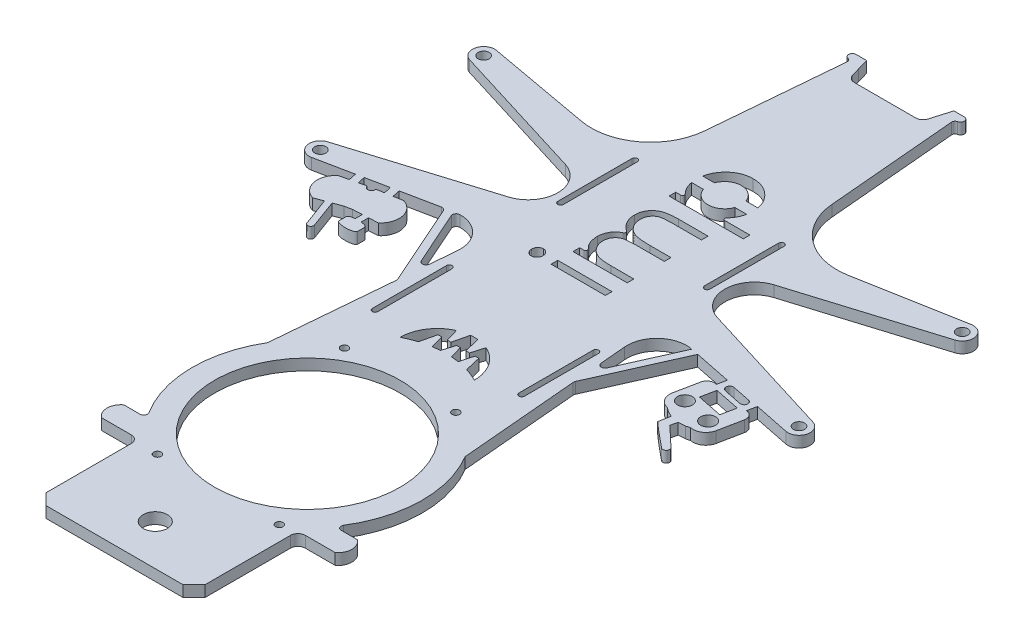
from build123d import *

# Parameters (mm, degrees)
SKETCH_1_R          = 1.5
SKETCH_1_R_2        = 25
SKETCH_1_R_3        = 1
SKETCH_1_R_4        = 2
EXTRUDE_1_DEPTH     = 3
CUT_EXTRUDE_1_DEPTH = 3
EXTRUDE_2_DEPTH     = 3
CUT_EXTRUDE_2_DEPTH = 3
SKETCH_6_R          = 3.25
EXTRUDE_3_DEPTH     = 3
EXTRUDE_4_DEPTH     = 3
SKETCH_8_W          = 14.615384615
SKETCH_8_H          = 1.794871795
CUT_EXTRUDE_3_DEPTH = 10
EXTRUDE_6_DEPTH     = 3
FILLET_2_R          = 2
FILLET_3_R          = 2
FILLET_4_R          = 1
FILLET_5_R          = 1
EXTRUDE_7_DEPTH     = 3
FILLET_6_R          = 1
FILLET_7_R          = 1
FILLET_11_R         = 1
FILLET_12_R         = 1
FILLET_13_R         = 1
FILLET_14_R         = 1
FILLET_22_R         = 0.5
FILLET_23_R         = 0.5
FILLET_24_R         = 0.5
FILLET_25_R         = 0.5
EXTRUDE_8_DEPTH     = 3


with BuildPart() as part:
    # 草图1 → 凸台-拉伸1 (new body)
    with BuildSketch(Plane(origin=(0, 0, 0), x_dir=(1, 0, 0), z_dir=(0, 1, 0))):
        with BuildLine():
            Line((-65.384333619, -19.133302588), (-28.141777015, -7.644526431))
            ThreePointArc((-28.141777015, -7.644526431), (-22.5, 0), (-28.141777015, 7.644526431))
            Line((-28.141777015, 7.644526431), (-65.384333619, 19.133302588))
            ThreePointArc((-65.384333619, 19.133302588), (-67.41435877, 22.711697239), (-63.963475544, 24.951633702))
            Line((-63.963475544, 24.951633702), (-35.956989403, 19.860837807))
            ThreePointArc((-35.956989403, 19.860837807), (-23.387681178, 22.884481961), (-17.156151846, 34.211351583))
            Line((-17.156151846, 34.211351583), (-14.077866308, 69.471713196))
            ThreePointArc((-14.077866308, 69.471713196), (-14.227947416, 70.111656421), (-14.777866308, 70.471713196))
            ThreePointArc((-14.777866308, 70.471713196), (-15.58285387, 71.562211952), (-14.577866308, 72.471713196))
            Line((-14.577866308, 72.471713196), (-11.764219385, 72.471713196))
            Line((-11.764219385, 72.471713196), (-10.884480237, 69.471713196))
            Line((-10.884480237, 69.471713196), (-10.181933712, 67.110709467))
            ThreePointArc((-10.181933712, 67.110709467), (-9.460655522, 66.077868179), (-8.265, 65.681117341))
            Line((-8.265, 65.681117341), (8.265, 65.681117341))
            ThreePointArc((8.265, 65.681117341), (9.462435388, 66.079197089), (10.183195998, 67.114968849))
            Line((10.183195998, 67.114968849), (10.878780421, 69.471713196))
            Line((10.878780421, 69.471713196), (11.764219385, 72.471713196))
            Line((11.764219385, 72.471713196), (14.577866308, 72.471713196))
            ThreePointArc((14.577866308, 72.471713196), (15.58285387, 71.562211952), (14.777866308, 70.471713196))
            ThreePointArc((14.777866308, 70.471713196), (14.227947416, 70.111656421), (14.077866308, 69.471713196))
            Line((14.077866308, 69.471713196), (17.156151846, 34.211351583))
            ThreePointArc((17.156151846, 34.211351583), (23.387681178, 22.884481961), (35.956989403, 19.860837807))
            Line((35.956989403, 19.860837807), (63.963475544, 24.951633702))
            ThreePointArc((63.963475544, 24.951633702), (67.41435877, 22.711697239), (65.384333619, 19.133302588))
            Line((65.384333619, 19.133302588), (28.141777015, 7.644526431))
            ThreePointArc((28.141777015, 7.644526431), (22.5, 0), (28.141777015, -7.644526431))
            Line((28.141777015, -7.644526431), (65.384333619, -19.133302588))
            ThreePointArc((65.384333619, -19.133302588), (67.406788203, -22.742012359), (63.902111383, -24.939817886))
            Line((63.902111383, -24.939817886), (56.552566669, -23.445096344))
            Line((56.552566669, -23.445096344), (54.298706289, -22.986715071))
            Line((54.298706289, -22.986715071), (53.800465775, -25.436563309))
            Line((53.800465775, -25.436563309), (54.094447564, -25.496352171))
            ThreePointArc((54.094447564, -25.496352171), (55.363545991, -26.352234716), (55.655733743, -27.854823172))
            Line((55.655733743, -27.854823172), (54.360308407, -34.224428592))
            ThreePointArc((54.360308407, -34.224428592), (52.862513952, -36.44535084), (50.232984154, -36.956679406))
            Line((50.232984154, -36.956679406), (49.153396756, -37.247352848))
            Line((49.153396756, -37.247352848), (47.289857921, -37.378589325))
            Line((47.289857921, -37.378589325), (46.865701298, -39.226418806))
            Line((46.865701298, -39.226418806), (47.842520442, -40.090507923))
            Line((47.842520442, -40.090507923), (52.204032724, -44.215700114))
            ThreePointArc((52.204032724, -44.215700114), (52.28182782, -45.486112615), (51.011415319, -45.563907712))
            Line((51.011415319, -45.563907712), (46.384876948, -41.738317209))
            Line((46.384876948, -41.738317209), (44.392211968, -39.975616168))
            Line((44.392211968, -39.975616168), (44.938003613, -36.900278432))
            Line((44.938003613, -36.900278432), (43.273760984, -36.051575614))
            Line((43.273760984, -36.051575614), (42.393469791, -35.362309761))
            ThreePointArc((42.393469791, -35.362309761), (40.172547544, -33.864515306), (39.661218978, -31.234985508))
            Line((39.661218978, -31.234985508), (40.956644314, -24.865380088))
            ThreePointArc((40.956644314, -24.865380088), (41.81252686, -23.596281661), (43.315115316, -23.304093909))
            Line((43.315115316, -23.304093909), (43.609097105, -23.363882771))
            Line((43.609097105, -23.363882771), (44.107337619, -20.914034532))
            Line((44.107337619, -20.914034532), (41.853477239, -20.455653259))
            Line((41.853477239, -20.455653259), (32.064056542, -18.464719321))
            ThreePointArc((32.064056542, -18.464719321), (25.142969185, -20.335475151), (22.5, -27))
            Line((22.5, -27), (28, -90))
            Line((28, -90), (28, -109.5))
            ThreePointArc((28, -109.5), (24.924621202, -116.924621202), (17.5, -120))
            Line((17.5, -120), (-17.5, -120))
            ThreePointArc((-17.5, -120), (-24.924621202, -116.924621202), (-28, -109.5))
            Line((-28, -109.5), (-28, -90))
            Line((-28, -90), (-22.5, -27))
            ThreePointArc((-22.5, -27), (-25.142969185, -20.335475151), (-32.064056542, -18.464719321))
            Line((-32.064056542, -18.464719321), (-41.853477239, -20.455653259))
            Line((-41.853477239, -20.455653259), (-44.303325478, -20.953893774))
            Line((-44.303325478, -20.953893774), (-43.880204303, -23.034380277))
            Line((-43.880204303, -23.034380277), (-41.415025587, -22.611519709))
            ThreePointArc((-41.415025587, -22.611519709), (-37.965652689, -26.400073845), (-39.661218978, -31.234985508))
            Line((-39.661218978, -31.234985508), (-42.155849958, -31.354795682))
            Line((-42.155849958, -31.354795682), (-42.155849958, -33.354795682))
            add(Edge.make_bspline(
                [(-40.455849958, -34.065358839), (-40.455849958, -33.527053417), (-42.155849958, -33.354795682)],
                knots=[3.141592654, 3.141592654, 3.141592654, 4.386659493, 4.386659493, 4.386659493], degree=2, weights=[1, 0.81240384, 1]))
            Line((-40.455849958, -34.065358839), (-40.455849958, -36.065358839))
            add(Edge.make_bspline(
                [(-45.455849958, -36.065358839), (-45.455849958, -36.815358839), (-42.955849958, -36.815358839), (-40.455849958, -36.815358839), (-40.455849958, -36.065358839)],
                knots=[3.141592654, 3.141592654, 3.141592654, 4.71238898, 4.71238898, 6.283185307, 6.283185307, 6.283185307], degree=2, weights=[1, 0.707106781, 1, 0.707106781, 1]))
            Line((-45.455849958, -36.065358839), (-45.455849958, -34.065358839))
            add(Edge.make_bspline(
                [(-43.755849958, -33.354795682), (-45.455849958, -33.527053417), (-45.455849958, -34.065358839)],
                knots=[5.038118468, 5.038118468, 5.038118468, 6.283185307, 6.283185307, 6.283185307], degree=2, weights=[1, 0.81240384, 1]))
            Line((-43.755849958, -33.354795682), (-43.755849958, -31.431639224))
            Line((-43.755849958, -31.431639224), (-46.230120603, -31.550471549))
            Line((-46.230120603, -31.550471549), (-48.189999193, -31.94906396))
            Line((-48.189999193, -31.94906396), (-50.524561924, -32.809957845))
            Line((-50.524561924, -32.809957845), (-47.756677611, -40.315876605))
            ThreePointArc((-47.756677611, -40.315876605), (-48.230481056, -41.343256912), (-49.257861364, -40.869453467))
            Line((-49.257861364, -40.869453467), (-52.025745676, -33.363534707))
            Line((-52.025745676, -33.363534707), (-54.360308407, -34.224428592))
            ThreePointArc((-54.360308407, -34.224428592), (-57.809681305, -30.435874456), (-56.114115016, -25.600962793))
            Line((-56.114115016, -25.600962793), (-53.679597255, -25.027342333))
            Line((-53.679597255, -25.027342333), (-54.10271843, -22.94685583))
            Line((-54.10271843, -22.94685583), (-56.552566669, -23.445096344))
            Line((-56.552566669, -23.445096344), (-63.902111383, -24.939817886))
            ThreePointArc((-63.902111383, -24.939817886), (-67.406788203, -22.742012359), (-65.384333619, -19.133302588))
        make_face()
        with Locations((-64.5, 22)):
            Circle(SKETCH_1_R, mode=Mode.SUBTRACT)
        with Locations((64.5, 22)):
            Circle(SKETCH_1_R, mode=Mode.SUBTRACT)
        with Locations((64.5, -22)):
            Circle(SKETCH_1_R, mode=Mode.SUBTRACT)
        with Locations((-64.5, -22)):
            Circle(SKETCH_1_R, mode=Mode.SUBTRACT)
        with Locations((0, -90)):
            Circle(SKETCH_1_R_2, mode=Mode.SUBTRACT)
        with Locations((-15, -65)):
            Circle(SKETCH_1_R_3, mode=Mode.SUBTRACT)
        with Locations((15, -65)):
            Circle(SKETCH_1_R_3, mode=Mode.SUBTRACT)
        with Locations((-15.42, -115)):
            Circle(SKETCH_1_R_3, mode=Mode.SUBTRACT)
        with Locations((17.43, -115)):
            Circle(SKETCH_1_R_3, mode=Mode.SUBTRACT)
        with Locations((43.190654614, -31.44255258)):
            Circle(SKETCH_1_R_4, mode=Mode.SUBTRACT)
        with Locations((51.030168976, -33.036922224)):
            Circle(SKETCH_1_R_4, mode=Mode.SUBTRACT)
        Polygon((45.075697701, -24.682625615), (51.935272768, -26.077699055), (51.138087945, -29.997456236), (44.278512878, -28.602382797), align=None, mode=Mode.SUBTRACT)
        with BuildLine():
            Line((-47.824490247, -23.710957187), (-45.852347275, -23.372668732))
            Line((-45.852347275, -23.372668732), (-46.263204068, -21.352486185))
            Line((-46.263204068, -21.352486185), (-52.14283984, -22.548263418))
            Line((-52.14283984, -22.548263418), (-51.731983047, -24.568445966))
            Line((-51.731983047, -24.568445966), (-49.784368838, -24.109549598))
            ThreePointArc((-49.784368838, -24.109549598), (-48.605133337, -24.890192687), (-47.824490247, -23.710957187))
        make_face(mode=Mode.SUBTRACT)
        with BuildLine():
            Line((46.703349664, -21.697119111), (51.603046141, -22.693600139))
            ThreePointArc((51.603046141, -22.693600139), (52.38368923, -23.87283564), (51.20445373, -24.65347873))
            Line((51.20445373, -24.65347873), (46.304757253, -23.656997702))
            ThreePointArc((46.304757253, -23.656997702), (45.524114164, -22.477762201), (46.703349664, -21.697119111))
        make_face(mode=Mode.SUBTRACT)
    extrude(amount=EXTRUDE_1_DEPTH)

    # 草图2 → 切除-拉伸1 (cut)
    with BuildSketch(Plane.XZ):
        with BuildLine():
            Line((-19, 2), (-19, -18))
            ThreePointArc((-19, -18), (-19.75, -18.75), (-20.5, -18))
            Line((-20.5, -18), (-20.5, 2))
            ThreePointArc((-20.5, 2), (-19.75, 2.75), (-19, 2))
        make_face()
        with BuildLine():
            Line((20.5, 2), (20.5, -18))
            ThreePointArc((20.5, -18), (19.75, -18.75), (19, -18))
            Line((19, -18), (19, 2))
            ThreePointArc((19, 2), (19.75, 2.75), (20.5, 2))
        make_face()
        with BuildLine():
            Line((-19, 52), (-19, 32))
            ThreePointArc((-19, 32), (-19.75, 31.25), (-20.5, 32))
            Line((-20.5, 32), (-20.5, 52))
            ThreePointArc((-20.5, 52), (-19.75, 52.75), (-19, 52))
        make_face()
        with BuildLine():
            Line((20.5, 52), (20.5, 32))
            ThreePointArc((20.5, 32), (19.75, 31.25), (19, 32))
            Line((19, 32), (19, 52))
            ThreePointArc((19, 52), (19.75, 52.75), (20.5, 52))
        make_face()
        with BuildLine():
            ThreePointArc((-10, 55), (0, 45), (10, 55))
            ThreePointArc((10, 55), (0, 52.595917942), (-10, 55))
        make_face()
    extrude(amount=-CUT_EXTRUDE_1_DEPTH, mode=Mode.SUBTRACT)

    # 草图3 → 凸台-拉伸2 (add)
    with BuildSketch(Plane.XZ):
        Polygon((-1.5, 52.647113875), (-0.5, 49.295917942), (0.5, 49.295917942), (1.5, 52.647113875), (1.5, 53.876111313), (3.5, 53.876111313), (3.5, 52.876111313), (4.5, 49.295917942), (5.5, 49.295917942), (6.5, 53.578068385), (6.5, 54.578068385), (-6.5, 54.578068385), (-6.5, 53.578068385), (-5.5, 49.295917942), (-4.5, 49.295917942), (-3.5, 52.876111313), (-3.5, 53.876111313), (-1.5, 53.876111313), align=None)
        Polygon((-2, 49.295917942), (-1, 45.050125629), (-1, 44.050125629), (1, 44.050125629), (1, 45.050125629), (2, 49.295917942), (3, 49.295917942), (4, 45.83484861), (4, 43.83484861), (-4, 43.83484861), (-4, 45.83484861), (-3, 49.295917942), align=None)
    extrude(amount=-EXTRUDE_2_DEPTH)

    # 草图4 → 切除-拉伸2 (cut)
    with BuildSketch(Plane.XZ):
        with BuildLine():
            Line((-28, 108), (-21.44761059, 108))
            ThreePointArc((-21.44761059, 108), (-26.31095871, 99.57775818), (-28, 90))
            Line((-28, 90), (-28, 108))
        make_face()
        with BuildLine():
            Line((-21.44761059, 114), (-21.44761059, 119.229664467))
            ThreePointArc((-21.44761059, 119.229664467), (-24.708218651, 117.134892526), (-26.986832981, 114))
            Line((-26.986832981, 114), (-21.44761059, 114))
        make_face()
        with BuildLine():
            Line((21.44761059, 119.229664467), (21.44761059, 114))
            Line((21.44761059, 114), (26.986832981, 114))
            ThreePointArc((26.986832981, 114), (24.708218651, 117.134892526), (21.44761059, 119.229664467))
        make_face()
        with BuildLine():
            Line((21.44761059, 108), (28, 108))
            Line((28, 108), (28, 90))
            ThreePointArc((28, 90), (26.31095871, 99.57775818), (21.44761059, 108))
        make_face()
    extrude(amount=-CUT_EXTRUDE_2_DEPTH, mode=Mode.SUBTRACT)

    # 草图6 → 凸台-拉伸3 (add)
    with BuildSketch(Plane.XZ):
        Polygon((-21.44761059, 119.229664467), (-21.44761059, 139), (-18.44761059, 142), (18.44761059, 142), (21.44761059, 139), (21.44761059, 119.229664467), align=None)
        with Locations((0, 131)):
            Circle(SKETCH_6_R, mode=Mode.SUBTRACT)
    extrude(amount=-EXTRUDE_3_DEPTH)

    # 草图7 → 凸台-拉伸4 (add)
    with BuildSketch(Plane.XZ):
        with BuildLine():
            Line((-26.611915935, 74.100127979), (-28, 90))
            ThreePointArc((-28, 90), (-26.31095871, 99.57775818), (-21.44761059, 108))
            Line((-21.44761059, 108), (-25.238858928, 108))
            ThreePointArc((-25.238858928, 108), (-30.974603213, 91.254573939), (-26.611915935, 74.100127979))
        make_face()
        with BuildLine():
            Line((28, 90), (26.611915935, 74.100127979))
            ThreePointArc((26.611915935, 74.100127979), (30.974603213, 91.254573939), (25.238858928, 108))
            Line((25.238858928, 108), (21.44761059, 108))
            ThreePointArc((21.44761059, 108), (26.31095871, 99.57775818), (28, 90))
        make_face()
    extrude(amount=-EXTRUDE_4_DEPTH)

    # 草图8 → 切除-拉伸3 (cut)
    # profile 1 of 4: a face of its own
    with BuildSketch(Plane(origin=(0, 3, 0), x_dir=(1, 0, 0), z_dir=(0, 1, 0))):
        with BuildLine():
            add(Edge.make_bspline(
                [(-12.886726023, -16.695259177), (-12.881559438, -16.583880229), (-12.871442272, -16.365778859), (-12.78480526, -16.050388758), (-12.637949914, -15.763205832), (-12.440923166, -15.508475929), (-12.209212061, -15.28989372), (-11.939149385, -15.136861089), (-11.647385735, -15.03850454), (-11.443870939, -15.026627081), (-11.340251664, -15.02057969)],
                knots=[0, 0, 0, 0, 1.055194115, 2.066272739, 3.074728998, 4.095836921, 5.109056067, 6.073838105, 7.019297344, 8, 8, 8, 8], degree=3))
            add(Edge.make_bspline(
                [(-11.340251664, -15.02057969), (-11.239322217, -15.02676346), (-11.039796646, -15.038988042), (-10.753091091, -15.136785118), (-10.4867809, -15.291197906), (-10.255519698, -15.508335766), (-10.05860187, -15.763242972), (-9.911717648, -16.050378891), (-9.825088291, -16.365781454), (-9.81497007, -16.583881107), (-9.809802946, -16.695259177)],
                knots=[0, 0, 0, 0, 0.96129708, 1.900370562, 2.859976407, 3.87933698, 4.906634145, 5.921202961, 6.938410037, 8, 8, 8, 8], degree=3))
            add(Edge.make_bspline(
                [(-9.809802946, -16.695259177), (-9.814772776, -16.805363606), (-9.8244459, -17.019667493), (-9.91341743, -17.330335163), (-10.058652133, -17.615069389), (-10.254230334, -17.870296089), (-10.488201175, -18.08304005), (-10.752928569, -18.237887624), (-11.039838024, -18.335458835), (-11.239336117, -18.347713855), (-11.340251664, -18.353913023)],
                knots=[0, 0, 0, 0, 1.054934014, 2.053291228, 3.073705704, 4.106921865, 5.123545215, 6.088680038, 7.033164197, 8, 8, 8, 8], degree=3))
            add(Edge.make_bspline(
                [(-11.340251664, -18.353913023), (-11.443856519, -18.347849671), (-11.647342991, -18.335940865), (-11.939314607, -18.237814487), (-12.207780332, -18.084329871), (-12.442211757, -17.870155222), (-12.637899956, -17.615106878), (-12.783105565, -17.330325477), (-12.872084647, -17.019670052), (-12.881756729, -16.805364475), (-12.886726023, -16.695259177)],
                knots=[0, 0, 0, 0, 0.98631895, 1.937192651, 2.907499808, 3.917963147, 4.944918757, 5.95915025, 6.951458133, 8, 8, 8, 8], degree=3))
        make_face()
    # profile 2 of 4: a face of its own
    with BuildSketch(Plane(origin=(0, 3, 0), x_dir=(1, 0, 0), z_dir=(0, 1, 0))):
        with Locations((0.574812438, -16.687246357)):
            Rectangle(SKETCH_8_W, SKETCH_8_H)
    # profile 3 of 4: a face of its own
    with BuildSketch(Plane(origin=(0, 3, 0), x_dir=(1, 0, 0), z_dir=(0, 1, 0))):
        with BuildLine():
            Line((-6.732879869, -11.687246356), (-6.732879869, -9.892374561))
            Line((-6.732879869, -9.892374561), (-4.192815766, -9.892374561))
            add(Edge.make_bspline(
                [(-4.192815766, -9.892374561), (-4.415030633, -9.73075199), (-4.840815622, -9.42106765), (-5.401902961, -8.913263921), (-5.878063845, -8.40597185), (-6.128023111, -8.04063824), (-6.248104228, -7.865130972)],
                knots=[0, 0, 0, 0, 1.134379233, 2.173579362, 3.122582517, 4, 4, 4, 4], degree=3))
            add(Edge.make_bspline(
                [(-6.248104228, -7.865130972), (-6.362420601, -7.625904331), (-6.589056106, -7.151630618), (-6.818962157, -6.400663618), (-6.96024845, -5.632236935), (-6.979570584, -5.113332856), (-6.989290125, -4.852310459)],
                knots=[0, 0, 0, 0, 1.014936303, 2.012140481, 3.000054389, 4, 4, 4, 4], degree=3))
            add(Edge.make_bspline(
                [(-6.989290125, -4.852310459), (-6.983316942, -4.675779143), (-6.971496333, -4.326433162), (-6.894583207, -3.808808427), (-6.761628501, -3.30676437), (-6.576462993, -2.823236405), (-6.352126323, -2.367759648), (-6.089230726, -1.949861169), (-5.793533674, -1.576493486), (-5.456545498, -1.241672677), (-5.059565631, -0.943243808), (-4.594980761, -0.670655267), (-4.056094738, -0.415435787), (-3.665357229, -0.274871892), (-3.459642689, -0.200868151)],
                knots=[0, 0, 0, 0, 1.009731074, 1.9982035, 2.985760524, 3.974587072, 4.955028184, 5.885388378, 6.793242796, 7.673688873, 8.594941726, 9.625945874, 10.750113716, 12, 12, 12, 12], degree=3))
            add(Edge.make_bspline(
                [(-3.459642689, -0.200868151), (-3.600923548, -0.122516711), (-3.878944436, 0.03166792), (-4.27244219, 0.290536806), (-4.640400754, 0.561856124), (-4.983582349, 0.847499422), (-5.299255188, 1.148666317), (-5.593859271, 1.460504363), (-5.859235293, 1.78999696), (-6.169749122, 2.245748162), (-6.500632643, 2.838098992), (-6.780285539, 3.587854704), (-6.958382103, 4.36481427), (-6.978919375, 4.89299314), (-6.989290125, 5.159708772)],
                knots=[0, 0, 0, 0, 0.861026002, 1.694378253, 2.508904292, 3.297437177, 4.073006284, 4.833627155, 5.583069468, 6.325614666, 7.772320565, 9.187282923, 10.579656144, 12, 12, 12, 12], degree=3))
            add(Edge.make_bspline(
                [(-6.989290125, 5.159708772), (-6.980164632, 5.404788282), (-6.962305154, 5.88443268), (-6.818747101, 6.58153261), (-6.581145391, 7.234432674), (-6.247003391, 7.836212796), (-5.829103217, 8.379880239), (-5.331294275, 8.854251838), (-4.755394713, 9.248897547), (-4.217951323, 9.512728994), (-3.742577496, 9.688365433), (-3.335696481, 9.798057508), (-2.887511184, 9.893090774), (-2.398382084, 9.973664652), (-1.867318843, 10.031915874), (-1.294077458, 10.07521915), (-0.678159801, 10.104487257), (-0.253214476, 10.106558002), (-0.03416192, 10.107625439)],
                knots=[0, 0, 0, 0, 1.209392158, 2.366897878, 3.497663982, 4.628180075, 5.751982922, 6.871462727, 8.009245026, 9.185977379, 9.818124946, 10.509294143, 11.264649411, 12.079922034, 12.956003306, 13.901808055, 14.918415426, 16, 16, 16, 16], degree=3))
            Line((-0.03416192, 10.107625439), (7.882504746, 10.107625439))
            Line((7.882504746, 10.107625439), (7.882504746, 8.312753644))
            Line((7.882504746, 8.312753644), (-0.042174741, 8.312753644))
            add(Edge.make_bspline(
                [(-0.042174741, 8.312753644), (-0.229149724, 8.312310759), (-0.588487207, 8.311459601), (-1.104211879, 8.296039014), (-1.574328733, 8.267131027), (-1.999451397, 8.232810379), (-2.379446458, 8.18641873), (-2.713249783, 8.125167289), (-3.002384394, 8.060792729), (-3.322786066, 7.953591969), (-3.675935078, 7.783806377), (-4.05401156, 7.520476321), (-4.385688848, 7.193677763), (-4.673633673, 6.814244855), (-4.907927573, 6.382604081), (-5.075206644, 5.906787646), (-5.178769402, 5.389855219), (-5.189089002, 5.032010004), (-5.19441833, 4.847208772)],
                knots=[0, 0, 0, 0, 1.253367865, 2.408782419, 3.458086102, 4.410454771, 5.267690823, 6.022776742, 6.685072793, 7.251272234, 8.28433411, 9.300106008, 10.325693114, 11.39283262, 12.482417211, 13.60372085, 14.762494729, 16, 16, 16, 16], degree=3))
            add(Edge.make_bspline(
                [(-5.19441833, 4.847208772), (-5.184068019, 4.620708193), (-5.163630118, 4.173456312), (-5.009972151, 3.516767389), (-4.754584283, 2.892432312), (-4.405299338, 2.304666254), (-3.976224641, 1.768959312), (-3.468477302, 1.306396199), (-2.893303661, 0.924572258), (-2.361072388, 0.665965365), (-1.882957865, 0.502586444), (-1.465252624, 0.394770801), (-0.989230441, 0.310399174), (-0.46047301, 0.232802746), (0.12552205, 0.180434383), (0.765136398, 0.134172682), (1.462748548, 0.112244239), (1.946331146, 0.10920396), (2.197408593, 0.107625439)],
                knots=[0, 0, 0, 0, 1.091136677, 2.154576964, 3.231646693, 4.331257757, 5.439166191, 6.528231045, 7.628049365, 8.756709726, 9.369482423, 10.061167346, 10.833871401, 11.698739631, 12.636505159, 13.668922441, 14.789697963, 16, 16, 16, 16], degree=3))
            Line((2.197408593, 0.107625439), (7.882504746, 0.107625439))
            Line((7.882504746, 0.107625439), (7.882504746, -1.687246356))
            Line((7.882504746, -1.687246356), (0.450613721, -1.687246356))
            add(Edge.make_bspline(
                [(0.450613721, -1.687246356), (0.240937614, -1.687700248), (-0.16245814, -1.68857349), (-0.740936293, -1.703866725), (-1.267113865, -1.732933159), (-1.740379465, -1.766536214), (-2.15987248, -1.814880338), (-2.527843423, -1.869792507), (-2.843364992, -1.934644008), (-3.189451952, -2.042005936), (-3.570645707, -2.206146569), (-3.977441102, -2.469847139), (-4.332843001, -2.800470104), (-4.640943771, -3.184031211), (-4.89270587, -3.618961385), (-5.06767862, -4.100450514), (-5.174429244, -4.620611486), (-5.187629646, -4.979989855), (-5.19441833, -5.164810459)],
                knots=[0, 0, 0, 0, 1.320285835, 2.540097241, 3.643286278, 4.638464947, 5.527188413, 6.301437306, 6.980978976, 7.552872752, 8.580906713, 9.583871393, 10.589652407, 11.624542289, 12.671761011, 13.738681301, 14.837052193, 16, 16, 16, 16], degree=3))
            add(Edge.make_bspline(
                [(-5.19441833, -5.164810459), (-5.185672816, -5.382045898), (-5.168243318, -5.814988414), (-5.011362174, -6.451000487), (-4.765622967, -7.065201212), (-4.424716062, -7.647811826), (-4.002411596, -8.183046003), (-3.505844038, -8.651837596), (-2.941640826, -9.044457068), (-2.417264272, -9.30755416), (-1.950985867, -9.476225367), (-1.552981602, -9.586811701), (-1.111878468, -9.683877879), (-0.626762447, -9.755215017), (-0.099798852, -9.824297584), (0.471716754, -9.85759811), (1.087270301, -9.890011579), (1.512256453, -9.89156758), (1.732665003, -9.892374561)],
                knots=[0, 0, 0, 0, 1.09880202, 2.189873405, 3.297736452, 4.440485332, 5.596193377, 6.739822772, 7.886349079, 9.066114917, 9.699498033, 10.395421758, 11.156987371, 11.985484089, 12.878178647, 13.847820956, 14.883825601, 16, 16, 16, 16], degree=3))
            Line((1.732665003, -9.892374561), (7.882504746, -9.892374561))
            Line((7.882504746, -9.892374561), (7.882504746, -11.687246356))
            Line((7.882504746, -11.687246356), (-6.732879869, -11.687246356))
        make_face()
    # profile 4 of 4: a face of its own
    with BuildSketch(Plane(origin=(0, 3, 0), x_dir=(1, 0, 0), z_dir=(0, 1, 0))):
        with BuildLine():
            Line((-6.732879869, 14.210189541), (-6.732879869, 16.005061336))
            Line((-6.732879869, 16.005061336), (-4.028552946, 16.005061336))
            add(Edge.make_bspline(
                [(-4.028552946, 16.005061336), (-4.272022893, 16.19622495), (-4.746659978, 16.568892466), (-5.3687579, 17.201483167), (-5.882796474, 17.881143639), (-6.297245926, 18.603587769), (-6.603313101, 19.373402332), (-6.831093731, 20.179582615), (-6.964916469, 21.031312129), (-6.981058078, 21.613566555), (-6.989290125, 21.910510054)],
                knots=[0, 0, 0, 0, 1.07939028, 2.104237756, 3.085658289, 4.045737152, 5.001099604, 5.968961907, 6.964192404, 8, 8, 8, 8], degree=3))
            add(Edge.make_bspline(
                [(-6.989290125, 21.910510054), (-6.981786246, 22.169890644), (-6.966954434, 22.682570005), (-6.866536979, 23.437217028), (-6.69443588, 24.163933505), (-6.446430649, 24.858608099), (-6.139827964, 25.528682758), (-5.752873475, 26.164237614), (-5.304838099, 26.775172217), (-4.789225808, 27.346121869), (-4.23135, 27.873672541), (-3.631222548, 28.329936433), (-3.008579197, 28.723490172), (-2.353767242, 29.041606152), (-1.671943071, 29.290796708), (-0.96035198, 29.468023438), (-0.221632321, 29.573495686), (0.28066894, 29.587646839), (0.534748336, 29.594804926)],
                knots=[0, 0, 0, 0, 1.041296284, 2.058176809, 3.050446431, 4.034000596, 5.01514041, 6.003636468, 7.015969324, 8.052561599, 9.08815499, 10.094063707, 11.074456064, 12.040834395, 13.011057502, 13.983766392, 14.980127149, 16, 16, 16, 16], degree=3))
            add(Edge.make_bspline(
                [(0.534748336, 29.594804926), (0.794190099, 29.587802151), (1.305846696, 29.573991669), (2.057201538, 29.466877349), (2.779986531, 29.295695212), (3.472999466, 29.049648451), (4.135763187, 28.731697089), (4.767799736, 28.344813887), (5.368906611, 27.888319789), (5.930923183, 27.366599059), (6.448633543, 26.800582282), (6.901422512, 26.195568056), (7.281658942, 25.560945624), (7.599275854, 24.899961812), (7.838659763, 24.206958164), (8.01133291, 23.485168005), (8.117815742, 22.734984311), (8.131827985, 22.224692014), (8.138915003, 21.966599798)],
                knots=[0, 0, 0, 0, 1.038740735, 2.04854663, 3.033179607, 4.009277356, 4.987731542, 5.972001279, 6.972200261, 8.005528982, 9.039189865, 10.040446548, 11.026516639, 11.997840187, 12.972163198, 13.956796175, 14.96660207, 16, 16, 16, 16], degree=3))
            add(Edge.make_bspline(
                [(8.138915003, 21.966599798), (8.130939352, 21.676266168), (8.115191082, 21.102989758), (7.975414996, 20.262416046), (7.745849946, 19.457090953), (7.423906536, 18.689380643), (7.010425099, 17.957146838), (6.507102104, 17.263276881), (5.914024841, 16.604335707), (5.464135026, 16.207712609), (5.234267567, 16.005061336)],
                knots=[0, 0, 0, 0, 1.014661154, 2.003492687, 2.970165371, 3.937187664, 4.907406957, 5.904113462, 6.929124205, 8, 8, 8, 8], degree=3))
            Line((5.234267567, 16.005061336), (13.267120131, 16.005061336))
            Line((13.267120131, 16.005061336), (13.267120131, 14.210189541))
            Line((13.267120131, 14.210189541), (-6.732879869, 14.210189541))
        make_face()
        with BuildLine():
            add(Edge.make_bspline(
                [(-5.19441833, 21.894484413), (-5.190759712, 21.691172627), (-5.183556836, 21.290904126), (-5.097991414, 20.704205732), (-4.97377575, 20.139089002), (-4.785707749, 19.601249279), (-4.554857388, 19.085531471), (-4.266388752, 18.595907672), (-3.925520147, 18.132721572), (-3.538781039, 17.697138541), (-3.112639964, 17.303634007), (-2.657852484, 16.955274419), (-2.174994543, 16.662661247), (-1.6685639, 16.419792559), (-1.134590842, 16.234973801), (-0.576116484, 16.10379826), (0.007470444, 16.021339101), (0.404933339, 16.010545173), (0.606863721, 16.005061336)],
                knots=[0, 0, 0, 0, 1.05670511, 2.080379991, 3.077984906, 4.06214886, 5.038337365, 6.01289324, 7.01187578, 8.025460281, 9.038092164, 10.024533457, 11.000252242, 11.969694649, 12.940728589, 13.933144304, 14.949937299, 16, 16, 16, 16], degree=3))
            add(Edge.make_bspline(
                [(0.606863721, 16.005061336), (0.87192853, 16.014190158), (1.391212939, 16.032074295), (2.148872706, 16.176080314), (2.865208705, 16.413076216), (3.535559219, 16.748148977), (4.155767846, 17.166701253), (4.704658074, 17.680148628), (5.189420062, 18.269400467), (5.597727714, 18.932806129), (5.927597083, 19.644641021), (6.171214832, 20.384658036), (6.315812821, 21.147664084), (6.334582123, 21.662842251), (6.344043208, 21.922529285)],
                knots=[0, 0, 0, 0, 1.037533453, 2.032615907, 3.008487753, 3.983910949, 4.958815134, 5.928528047, 6.917017829, 7.938835504, 8.970843303, 9.983125212, 10.983349323, 12, 12, 12, 12], degree=3))
            add(Edge.make_bspline(
                [(6.344043208, 21.922529285), (6.335149367, 22.177019089), (6.317496692, 22.682135601), (6.164710861, 23.425900686), (5.931296129, 24.148687531), (5.591011306, 24.835495278), (5.173717406, 25.479961594), (4.673487556, 26.063791665), (4.089732375, 26.569571195), (3.44405306, 27.004781884), (2.752316298, 27.352715187), (2.037893906, 27.617009764), (1.300914811, 27.767580523), (0.803817242, 27.78913482), (0.554780388, 27.799933131)],
                knots=[0, 0, 0, 0, 1.001123591, 1.987050352, 2.978152323, 3.984730168, 4.995502505, 5.994801396, 7.000994558, 8.027767845, 9.053126238, 10.042874082, 11.019515457, 12, 12, 12, 12], degree=3))
            add(Edge.make_bspline(
                [(0.554780388, 27.799933131), (0.30418472, 27.791614723), (-0.195054223, 27.775042715), (-0.930905951, 27.612000989), (-1.65001883, 27.366531832), (-2.332956693, 27.01081947), (-2.973838915, 26.582346034), (-3.547071041, 26.075593605), (-4.039482972, 25.494610462), (-4.457107695, 24.855146062), (-4.783130163, 24.162245514), (-5.022899387, 23.435038549), (-5.16663385, 22.674707736), (-5.185075369, 22.15684657), (-5.19441833, 21.894484413)],
                knots=[0, 0, 0, 0, 0.984010603, 1.960354772, 2.950163297, 3.964735994, 4.97843856, 5.975353722, 6.962442164, 7.964544167, 8.969901786, 9.964615439, 10.968820376, 12, 12, 12, 12], degree=3))
        make_face(mode=Mode.SUBTRACT)
    extrude(amount=-CUT_EXTRUDE_3_DEPTH, mode=Mode.SUBTRACT)


with BuildPart() as cut_extrude_3_kept_piece:
    # of the separate pieces the step leaves, the one the design keeps (cut_extrude_3_pieces_kept)
    add(part.part.solids().sort_by_distance((44.938003613, 0, 36.900278432))[0])

    # 草图10 → 凸台-拉伸6 (add)
    with BuildSketch(Plane.XZ):
        with BuildLine():
            Line((-26.986832981, 114), (-31.486832981, 114))
            ThreePointArc((-31.486832981, 114), (-32.986832981, 111), (-31.486832981, 108))
            Line((-31.486832981, 108), (-26.986832981, 108))
            Line((-26.986832981, 108), (-26.986832981, 114))
        make_face()
        with BuildLine():
            Line((26.986832981, 108), (26.986832981, 114))
            Line((26.986832981, 114), (31.486832981, 114))
            ThreePointArc((31.486832981, 114), (32.986832981, 111), (31.486832981, 108))
            Line((31.486832981, 108), (26.986832981, 108))
        make_face()
    extrude(amount=-EXTRUDE_6_DEPTH)

    # 圆角2
    fillet_2_edges = [cut_extrude_3_kept_piece.edges().sort_by_distance(p)[0] for p in [
        (-21.44761059, 1.5, 114),
    ]]
    fillet(fillet_2_edges, radius=FILLET_2_R)

    # 圆角3
    fillet_3_edges = [cut_extrude_3_kept_piece.edges().sort_by_distance(p)[0] for p in [
        (21.44761059, 1.5, 114),
    ]]
    fillet(fillet_3_edges, radius=FILLET_3_R)

    # 圆角4
    fillet_4_edges = [cut_extrude_3_kept_piece.edges().sort_by_distance(p)[0] for p in [
        (-25.238858928, 1.5, 108),
    ]]
    fillet(fillet_4_edges, radius=FILLET_4_R)

    # 圆角5
    fillet_5_edges = [cut_extrude_3_kept_piece.edges().sort_by_distance(p)[0] for p in [
        (25.238858928, 1.5, 108),
    ]]
    fillet(fillet_5_edges, radius=FILLET_5_R)

    # 草图11 → 凸台-拉伸7 (add)
    with BuildSketch(Plane.XZ):
        Polygon((-32.064056542, 18.464719321), (-23.444919114, 37.823618943), (-23.803822596, 41.934695195), (-34.071552615, 18.872995989), align=None)
        Polygon((34.071552615, 18.872995989), (32.064056542, 18.464719321), (23.444919114, 37.823618943), (23.803822596, 41.934695195), align=None)
    extrude(amount=-EXTRUDE_7_DEPTH)

    # 圆角6
    fillet_6_edges = [cut_extrude_3_kept_piece.edges().sort_by_distance(p)[0] for p in [
        (23.803822596, 1.5, 41.934695195),
    ]]
    fillet(fillet_6_edges, radius=FILLET_6_R)

    # 圆角7
    fillet_7_edges = [cut_extrude_3_kept_piece.edges().sort_by_distance(p)[0] for p in [
        (23.444919114, 1.5, 37.823618943),
    ]]
    fillet(fillet_7_edges, radius=FILLET_7_R)

    # 圆角11
    fillet_11_edges = [cut_extrude_3_kept_piece.edges().sort_by_distance(p)[0] for p in [
        (-23.803822596, 1.5, 41.934695195),
    ]]
    fillet(fillet_11_edges, radius=FILLET_11_R)

    # 圆角12
    fillet_12_edges = [cut_extrude_3_kept_piece.edges().sort_by_distance(p)[0] for p in [
        (-34.071552615, 1.5, 18.872995989),
    ]]
    fillet(fillet_12_edges, radius=FILLET_12_R)

    # 圆角13
    fillet_13_edges = [cut_extrude_3_kept_piece.edges().sort_by_distance(p)[0] for p in [
        (-23.444919114, 1.5, 37.823618943),
    ]]
    fillet(fillet_13_edges, radius=FILLET_13_R)

    # 圆角14
    fillet_14_edges = [cut_extrude_3_kept_piece.edges().sort_by_distance(p)[0] for p in [
        (-32.064056542, 1.5, 18.464719321),
    ]]
    fillet(fillet_14_edges, radius=FILLET_14_R)

    # 圆角22
    fillet_22_edges = [cut_extrude_3_kept_piece.edges().sort_by_distance(p)[0] for p in [
        (-4.192815766, 1.5, 9.892374561),
    ]]
    fillet(fillet_22_edges, radius=FILLET_22_R)

    # 圆角23
    fillet_23_edges = [cut_extrude_3_kept_piece.edges().sort_by_distance(p)[0] for p in [
        (-3.459642689, 1.5, 0.200868151),
    ]]
    fillet(fillet_23_edges, radius=FILLET_23_R)

    # 圆角24
    fillet_24_edges = [cut_extrude_3_kept_piece.edges().sort_by_distance(p)[0] for p in [
        (-4.028552946, 1.5, -16.005061336),
    ]]
    fillet(fillet_24_edges, radius=FILLET_24_R)

    # 圆角25
    fillet_25_edges = [cut_extrude_3_kept_piece.edges().sort_by_distance(p)[0] for p in [
        (5.234267567, 1.5, -16.005061336),
    ]]
    fillet(fillet_25_edges, radius=FILLET_25_R)

    # 草图13 → 凸台-拉伸8 (add)
    with BuildSketch(Plane.XZ):
        with BuildLine():
            Line((4.803350562, -20.410510054), (9.803350562, -20.410510054))
            Line((9.803350562, -20.410510054), (9.803350562, -23.410510054))
            Line((9.803350562, -23.410510054), (4.803350562, -23.410510054))
            ThreePointArc((4.803350562, -23.410510054), (0.560709875, -26.410510054), (-3.681930812, -23.410510054))
            Line((-3.681930812, -23.410510054), (-8.681930812, -23.410510054))
            Line((-8.681930812, -23.410510054), (-8.681930812, -20.410510054))
            Line((-8.681930812, -20.410510054), (-3.681930812, -20.410510054))
            ThreePointArc((-3.681930812, -20.410510054), (0.560709875, -17.410510054), (4.803350562, -20.410510054))
        make_face()
    extrude(amount=-EXTRUDE_8_DEPTH)


solid = cut_extrude_3_kept_piece.part
